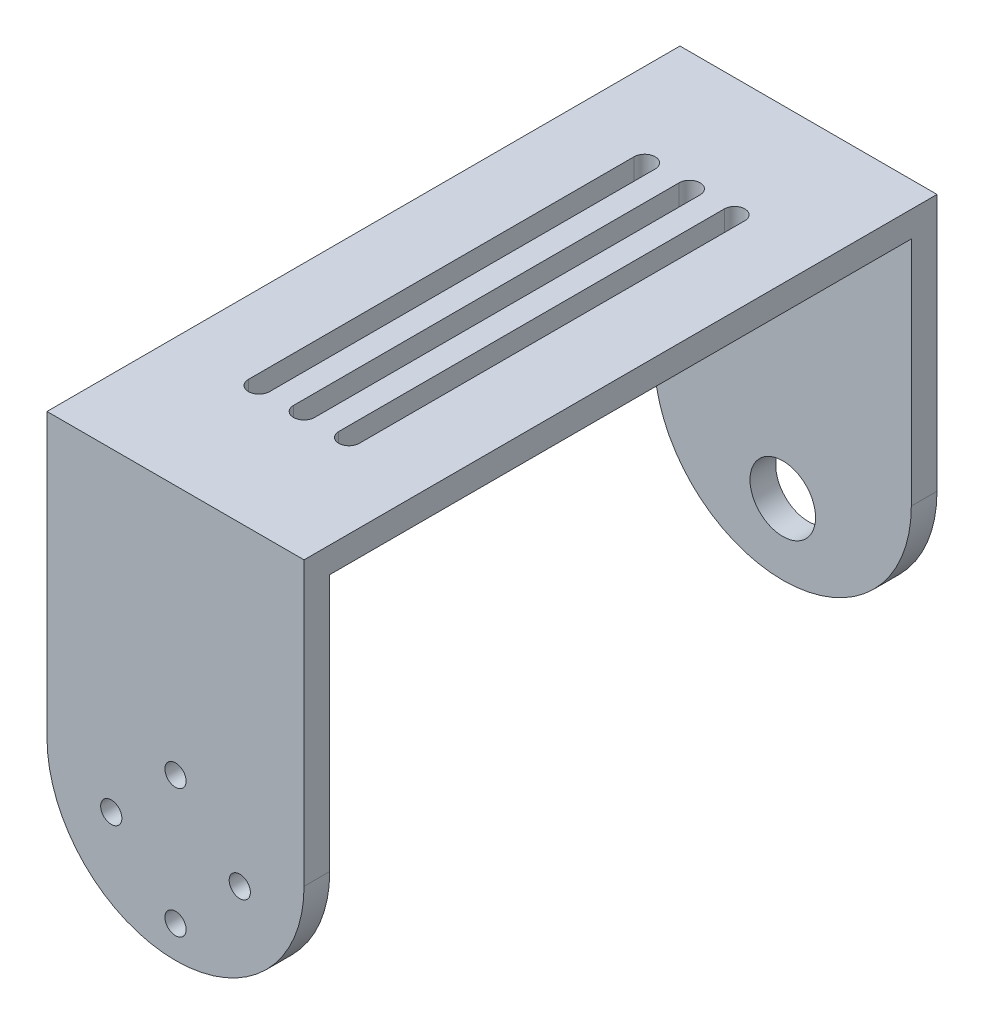
from build123d import *

# Parameters (mm, degrees)
SKETCH_1_R          = 1.65
EXTRUDE_1_DEPTH     = 4
EXTRUDE_START       = 4
SKETCH_2_W          = 40
SKETCH_2_H          = 4
EXTRUDE_2_DEPTH     = 98.5
EXTRUDE_START_2     = 49
SKETCH_4_W          = 40
SKETCH_4_H          = 4
EXTRUDE_3_DEPTH     = 60
FILLET_1_R          = 20
CUT_EXTRUDE_2_DEPTH = 109.310895112
CUT_EXTRUDE_START   = -90.5
SKETCH_8_R          = 5.1
CUT_EXTRUDE_3_DEPTH = 10


with BuildPart() as part:
    # 草图1 → 凸台-拉伸1 (new body)
    with BuildSketch(Plane.XY):
        Polygon((-20, 0), (-20, -15), (20, -15), (20, 3.147792708), (20, 45), (-20, 45), align=None)
        with Locations((-10, 0)):
            Circle(SKETCH_1_R, mode=Mode.SUBTRACT)
        with Locations((0, 10)):
            Circle(SKETCH_1_R, mode=Mode.SUBTRACT)
        with Locations((0, -10)):
            Circle(SKETCH_1_R, mode=Mode.SUBTRACT)
        with Locations((10, 0)):
            Circle(SKETCH_1_R, mode=Mode.SUBTRACT)
    extrude(amount=EXTRUDE_1_DEPTH)

    # 草图2 → 凸台-拉伸2 (add)
    with BuildSketch(Plane.XY.offset(EXTRUDE_START)):
        with Locations((0, 47)):
            Rectangle(SKETCH_2_W, SKETCH_2_H)
    extrude(amount=-EXTRUDE_2_DEPTH)

    # 草图4 → 凸台-拉伸3 (add)
    with BuildSketch(Plane(origin=(0, 0, 0), x_dir=(1, 0, 0), z_dir=(0, 1, 0)).offset(EXTRUDE_START_2)):
        with Locations((0, 92.5)):
            Rectangle(SKETCH_4_W, SKETCH_4_H)
    extrude(amount=-EXTRUDE_3_DEPTH)

    # 圆角1
    fillet_1_edges = [part.edges().sort_by_distance(p)[0] for p in [
        (-20, -11, -92.5),
        (20, -11, -92.5),
        (20, -15, 2),
        (-20, -15, 2),
    ]]
    fillet(fillet_1_edges, radius=FILLET_1_R - 0.0001)  # a hair under: the kernel refuses the full size

    # 草图6 → 切除-拉伸2 (cut, through all)
    with BuildSketch(Plane(origin=(0, 0, 0), x_dir=(1, 0, 0), z_dir=(0, 1, 0))):
        with BuildLine():
            Line((-8.65, 16), (-8.65, 76))
            ThreePointArc((-8.65, 76), (-7, 77.65), (-5.35, 76))
            Line((-5.35, 76), (-5.35, 16))
            ThreePointArc((-5.35, 16), (-7, 14.35), (-8.65, 16))
        make_face()
        with BuildLine():
            Line((1.634526819, 76), (1.634526819, 16))
            ThreePointArc((1.634526819, 16), (0, 14.365473181), (-1.634526819, 16))
            Line((-1.634526819, 16), (-1.634526819, 76))
            ThreePointArc((-1.634526819, 76), (0, 77.634526819), (1.634526819, 76))
        make_face()
        with BuildLine():
            Line((8.598187679, 76), (8.598187679, 16))
            ThreePointArc((8.598187679, 16), (7, 14.401812321), (5.401812321, 16))
            Line((5.401812321, 16), (5.401812321, 76))
            ThreePointArc((5.401812321, 76), (7, 77.598187679), (8.598187679, 76))
        make_face()
    extrude(amount=CUT_EXTRUDE_2_DEPTH, mode=Mode.SUBTRACT)

    # 草图8 → 切除-拉伸3 (cut)
    with BuildSketch(Plane.XY.offset(CUT_EXTRUDE_START)):
        Circle(SKETCH_8_R)
    extrude(amount=-CUT_EXTRUDE_3_DEPTH, mode=Mode.SUBTRACT)


solid = part.part
